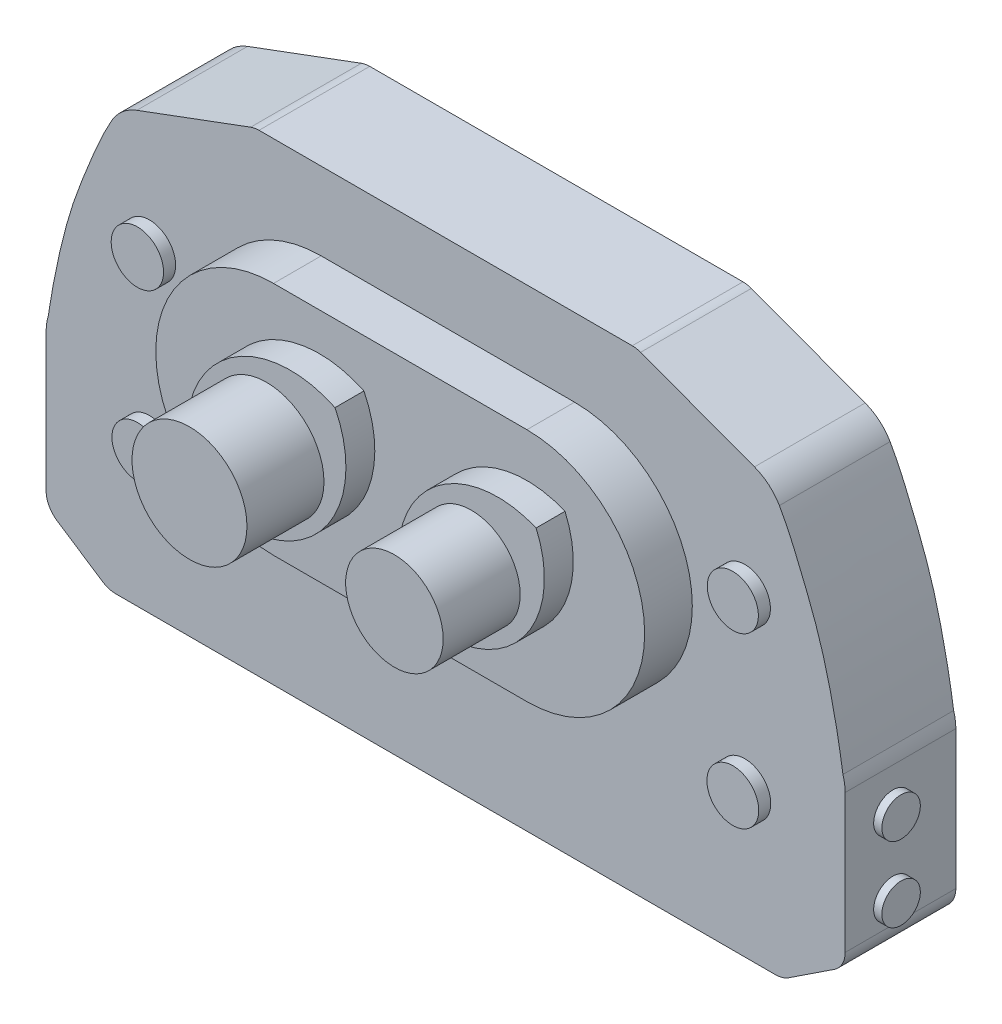
from build123d import *

# Parameters (mm, degrees)
BOSS_EXTRUDE1_DEPTH = 23
SKETCH5_R           = 4
BOSS_EXTRUDE3_DEPTH = 1.7
SKETCH8_R           = 4
BOSS_EXTRUDE4_DEPTH = 1.7
SKETCH12_R          = 5.309585237
SKETCH12_R_2        = 5.383577716
SKETCH12_R_3        = 5.290961271
SKETCH12_R_4        = 5.444301549
BOSS_EXTRUDE5_DEPTH = 9.9
BOSS_EXTRUDE6_DEPTH = 22
CUT_EXTRUDE1_START  = -16
SKETCH16_R          = 11.94
CUT_EXTRUDE1_DEPTH  = 16
CUT_EXTRUDE2_START  = -16
SKETCH17_R          = 10.13
CUT_EXTRUDE2_DEPTH  = 16
CUT_EXTRUDE3_START  = -7.4
SKETCH18_R          = 5.309585237
CUT_EXTRUDE3_DEPTH  = 7.4
CUT_EXTRUDE4_START  = -7.4
SKETCH19_R          = 5.383577716
CUT_EXTRUDE4_DEPTH  = 7.4
CUT_EXTRUDE5_START  = -7.4
SKETCH20_R          = 5.444301549
CUT_EXTRUDE5_DEPTH  = 7.4
CUT_EXTRUDE6_START  = -7.4
SKETCH21_R          = 5.290961271
CUT_EXTRUDE6_DEPTH  = 7.4


with BuildPart() as part:
    # Sketch2 → Boss-Extrude1 (new body)
    with BuildSketch(Plane.XY):
        with BuildLine():
            Line((70.523413182, -121.258597495), (80.001788964, -115.008475165))
            ThreePointArc((80.001788964, -115.008475165), (81.651709385, -113.204688447), (82.249297777, -110.834293536))
            Line((82.249297777, -110.834293536), (82.249297777, -82.060728072))
            ThreePointArc((82.249297777, -82.060728072), (82.132627635, -80.537642087), (81.785339594, -79.050095835))
            add(Edge.make_bspline(
                [(81.785339594, -79.050095835), (81.779550585, -79.03175941), (79.763594577, -64.21980724), (72.310783114, -44.632084365), (70.089271073, -39.87053002), (68.584818962, -37.26596578)],
                knots=[0.01010668, 0.01010668, 0.01010668, 0.01010668, 0.430228508, 0.512694162, 0.834763224, 0.834763224, 0.834763224, 0.834763224], degree=3))
            ThreePointArc((68.584818962, -37.26596578), (66.377835563, -34.627803803), (63.407507036, -32.893496223))
            Line((63.407507036, -32.893496223), (39.759590264, -24.109812278))
            ThreePointArc((39.759590264, -24.109812278), (38.90305511, -23.875770322), (38.018627658, -23.796927511))
            Line((38.018627658, -23.796927511), (-39.520032104, -23.796927511))
            ThreePointArc((-39.520032104, -23.796927511), (-40.404459556, -23.875770322), (-41.26099471, -24.109812278))
            Line((-41.26099471, -24.109812278), (-64.908911482, -32.893496223))
            ThreePointArc((-64.908911482, -32.893496223), (-67.879240009, -34.627803803), (-70.086223408, -37.26596578))
            add(Edge.make_bspline(
                [(-83.28674404, -79.050095835), (-83.280955031, -79.03175941), (-81.264999023, -64.21980724), (-73.81218756, -44.632084365), (-71.590675519, -39.87053002), (-70.086223408, -37.26596578)],
                knots=[0.01010668, 0.01010668, 0.01010668, 0.01010668, 0.430228508, 0.512694162, 0.834763224, 0.834763224, 0.834763224, 0.834763224], degree=3))
            ThreePointArc((-83.28674404, -79.050095835), (-83.634032081, -80.537642087), (-83.750702223, -82.060728072))
            Line((-83.750702223, -82.060728072), (-83.750702223, -110.834293536))
            ThreePointArc((-83.750702223, -110.834293536), (-83.153113831, -113.204688447), (-81.50319341, -115.008475165))
            Line((-81.50319341, -115.008475165), (-72.024817629, -121.258597495))
            ThreePointArc((-72.024817629, -121.258597495), (-70.709179228, -121.873513284), (-69.272326442, -122.084415867))
            Line((-69.272326442, -122.084415867), (67.770921996, -122.084415867))
            ThreePointArc((67.770921996, -122.084415867), (69.207774782, -121.873513284), (70.523413182, -121.258597495))
        make_face()
    extrude(amount=BOSS_EXTRUDE1_DEPTH)

    # Sketch5 → Boss-Extrude3 (add)
    with BuildSketch(Plane.ZY.offset(83.750702223)):
        with Locations((13.083649818, -90.551709518)):
            Circle(SKETCH5_R)
        with Locations((13.083649818, -106.069633318)):
            Circle(SKETCH5_R)
    extrude(amount=BOSS_EXTRUDE3_DEPTH)

    # Sketch8 → Boss-Extrude4 (add)
    with BuildSketch(Plane(origin=(82.249297777, 0, 0), x_dir=(0, 0, -1), z_dir=(1, 0, 0))):
        with Locations((-13.08, -90.550728072)):
            Circle(SKETCH8_R)
        with Locations((-13.08, -106.070728072)):
            Circle(SKETCH8_R)
    extrude(amount=BOSS_EXTRUDE4_DEPTH)

    # Sketch12 → Boss-Extrude5 (add)
    with BuildSketch(Plane.XY.offset(23)):
        with Locations((61.412858859, -56.74856372)):
            Circle(SKETCH12_R)
        with Locations((61.412858859, -91.784557501)):
            Circle(SKETCH12_R_2)
        with Locations((-62.293922582, -91.784557501)):
            Circle(SKETCH12_R_3)
        with Locations((-62.293922582, -56.74856372)):
            Circle(SKETCH12_R_4)
        with BuildLine():
            Line((26.03317791, -39.941081705), (-26.605656617, -39.941081705))
            ThreePointArc((-26.605656617, -39.941081705), (-51.069934746, -64.405359834), (-26.605656617, -88.869637962))
            Line((-26.605656617, -88.869637962), (26.03317791, -88.869637962))
            ThreePointArc((26.03317791, -88.869637962), (50.497456038, -64.405359834), (26.03317791, -39.941081705))
        make_face()
    extrude(amount=BOSS_EXTRUDE5_DEPTH)

    # Sketch15 → Boss-Extrude6 (add)
    with BuildSketch(Plane.XY.offset(32.9)):
        with BuildLine():
            ThreePointArc((-36.30694092, -78.897586955), (-32.416918561, -54.237740907), (-7.831564022, -49.901772358))
            ThreePointArc((-7.831564022, -49.901772358), (-11.721586381, -74.561618406), (-36.30694092, -78.897586955))
        make_face()
        with BuildLine():
            ThreePointArc((33.947027157, -50.665986501), (29.727203797, -73.404384895), (7.056950152, -77.976175614))
            ThreePointArc((7.056950152, -77.976175614), (11.276773512, -55.23777722), (33.947027157, -50.665986501))
        make_face()
    extrude(amount=BOSS_EXTRUDE6_DEPTH)

    # Sketch16 → Cut-Extrude1 (cut)
    with BuildSketch(Plane.XY.offset(54.9).offset(CUT_EXTRUDE1_START)):
        with BuildLine():
            ThreePointArc((-36.30694092, -78.897586955), (-32.416918561, -54.237740907), (-7.831564022, -49.901772358))
            ThreePointArc((-7.831564022, -49.901772358), (-11.721586381, -74.561618406), (-36.30694092, -78.897586955))
        make_face()
        with Locations((-22.069252471, -64.399679657)):
            Circle(SKETCH16_R, mode=Mode.SUBTRACT)
    extrude(amount=CUT_EXTRUDE1_DEPTH, mode=Mode.SUBTRACT)

    # Sketch17 → Cut-Extrude2 (cut)
    with BuildSketch(Plane.XY.offset(54.9).offset(CUT_EXTRUDE2_START)):
        with BuildLine():
            ThreePointArc((7.056950152, -77.976175614), (11.276773512, -55.23777722), (33.947027157, -50.665986501))
            ThreePointArc((33.947027157, -50.665986501), (29.727203797, -73.404384895), (7.056950152, -77.976175614))
        make_face()
        with Locations((20.501988655, -64.321081058)):
            Circle(SKETCH17_R, mode=Mode.SUBTRACT)
    extrude(amount=CUT_EXTRUDE2_DEPTH, mode=Mode.SUBTRACT)

    # Sketch18 → Cut-Extrude3 (cut)
    with BuildSketch(Plane.XY.offset(32.9).offset(CUT_EXTRUDE3_START)):
        with Locations((61.412858859, -56.74856372)):
            Circle(SKETCH18_R)
    extrude(amount=CUT_EXTRUDE3_DEPTH, mode=Mode.SUBTRACT)

    # Sketch19 → Cut-Extrude4 (cut)
    with BuildSketch(Plane.XY.offset(32.9).offset(CUT_EXTRUDE4_START)):
        with Locations((61.412858859, -91.784557501)):
            Circle(SKETCH19_R)
    extrude(amount=CUT_EXTRUDE4_DEPTH, mode=Mode.SUBTRACT)

    # Sketch20 → Cut-Extrude5 (cut)
    with BuildSketch(Plane.XY.offset(32.9).offset(CUT_EXTRUDE5_START)):
        with Locations((-62.293922582, -56.74856372)):
            Circle(SKETCH20_R)
    extrude(amount=CUT_EXTRUDE5_DEPTH, mode=Mode.SUBTRACT)

    # Sketch21 → Cut-Extrude6 (cut)
    with BuildSketch(Plane.XY.offset(32.9).offset(CUT_EXTRUDE6_START)):
        with Locations((-62.293922582, -91.784557501)):
            Circle(SKETCH21_R)
    extrude(amount=CUT_EXTRUDE6_DEPTH, mode=Mode.SUBTRACT)


solid = part.part
